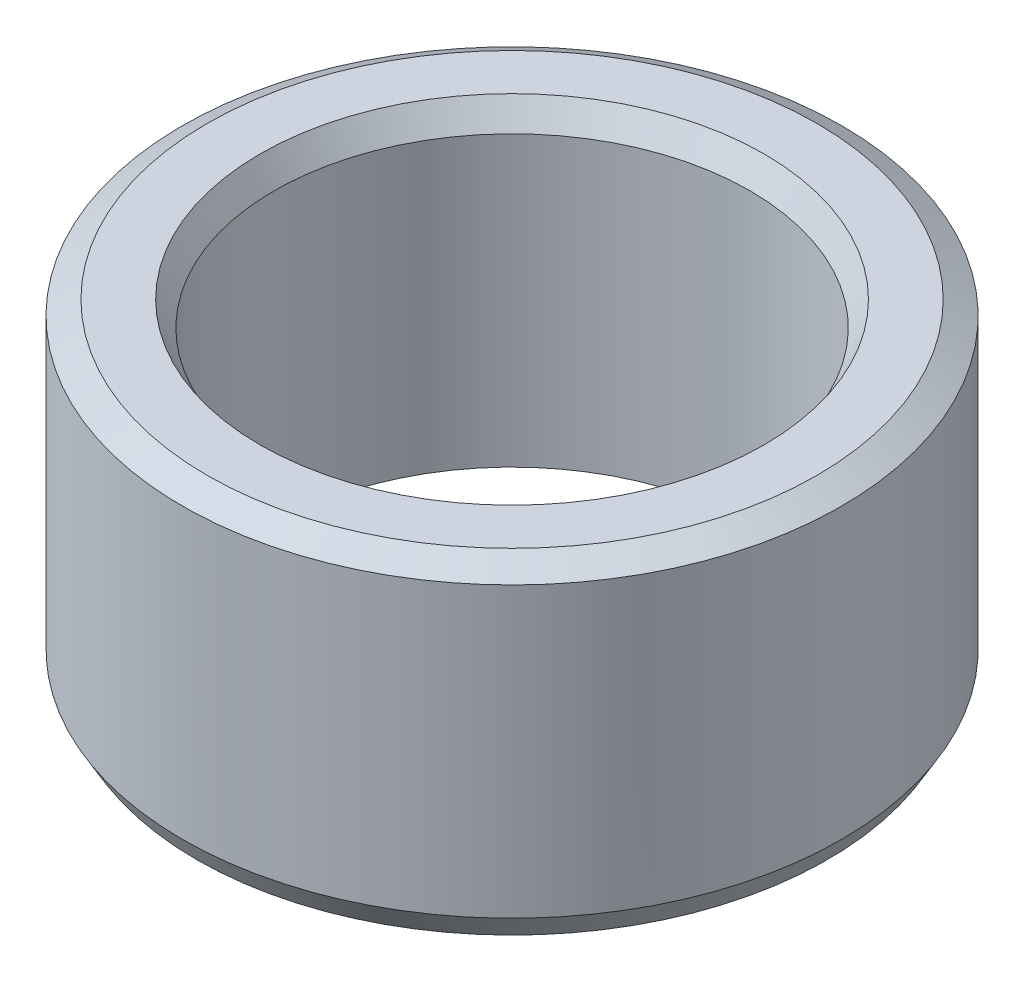
from build123d import *
from OCP.BRepFilletAPI import BRepFilletAPI_MakeChamfer

# Parameters (mm, degrees)
SKETCH1_R           = 22.5
BOSS_EXTRUDE1_DEPTH = 22.365063002
SKETCH2_R           = 16.232429279
CUT_EXTRUDE1_DEPTH  = 39.893393309
CHAMFER1_SIZE       = 0.973711287
CHAMFER1_SIZE2      = 1.686517421


with BuildPart() as part:
    # Sketch1 → Boss-Extrude1 (new body)
    with BuildSketch(Plane(origin=(0, 0, 0), x_dir=(1, 0, 0), z_dir=(0, 1, 0))):
        Circle(SKETCH1_R)
    extrude(amount=BOSS_EXTRUDE1_DEPTH)

    # Sketch2 → Cut-Extrude1 (cut, through all)
    with BuildSketch(Plane(origin=(0, 0, 0), x_dir=(1, 0, 0), z_dir=(0, 1, 0))):
        Circle(SKETCH2_R)
    extrude(amount=CUT_EXTRUDE1_DEPTH, mode=Mode.SUBTRACT)

    # Chamfer1: one chamfer whose edges measure the first distance from different faces: ONE call of the kernel's chamfer builder (chamfer() names one face for all edges)
    chamfer1_edges_1 = [part.edges().sort_by_distance(p)[0] for p in [
        (-16.232429279, 22.365063002, 0),
    ]]
    chamfer1_side_1 = [part.faces().sort_by_distance(p)[0] for p in [
        (-21.863603897, 22.365063002, 0),
    ]]
    chamfer1_edges_2 = [part.edges().sort_by_distance(p)[0] for p in [
        (-16.232429279, 0, 0),
    ]]
    chamfer1_side_2 = [part.faces().sort_by_distance(p)[0] for p in [
        (-16.232429279, 11.182531501, 0),
    ]]
    chamfer1_edges_3 = [part.edges().sort_by_distance(p)[0] for p in [
        (-22.5, 0, 0),
    ]]
    chamfer1_side_3 = [part.faces().sort_by_distance(p)[0] for p in [
        (-21.863603897, 0, 0),
    ]]
    chamfer1_edges_4 = [part.edges().sort_by_distance(p)[0] for p in [
        (-22.5, 22.365063002, 0),
    ]]
    chamfer1_side_4 = [part.faces().sort_by_distance(p)[0] for p in [
        (-22.5, 11.182531501, 0),
    ]]
    chamfer1 = BRepFilletAPI_MakeChamfer(part.part.solid().wrapped)
    for e in chamfer1_edges_1:
        chamfer1.Add(CHAMFER1_SIZE, CHAMFER1_SIZE2, e.wrapped, chamfer1_side_1[0].wrapped)  # the first distance lies on this face
    for e in chamfer1_edges_2:
        chamfer1.Add(CHAMFER1_SIZE, CHAMFER1_SIZE2, e.wrapped, chamfer1_side_2[0].wrapped)  # the first distance lies on this face
    for e in chamfer1_edges_3:
        chamfer1.Add(CHAMFER1_SIZE, CHAMFER1_SIZE2, e.wrapped, chamfer1_side_3[0].wrapped)  # the first distance lies on this face
    for e in chamfer1_edges_4:
        chamfer1.Add(CHAMFER1_SIZE, CHAMFER1_SIZE2, e.wrapped, chamfer1_side_4[0].wrapped)  # the first distance lies on this face
    add(Compound.cast(chamfer1.Shape()), mode=Mode.REPLACE)


solid = part.part
